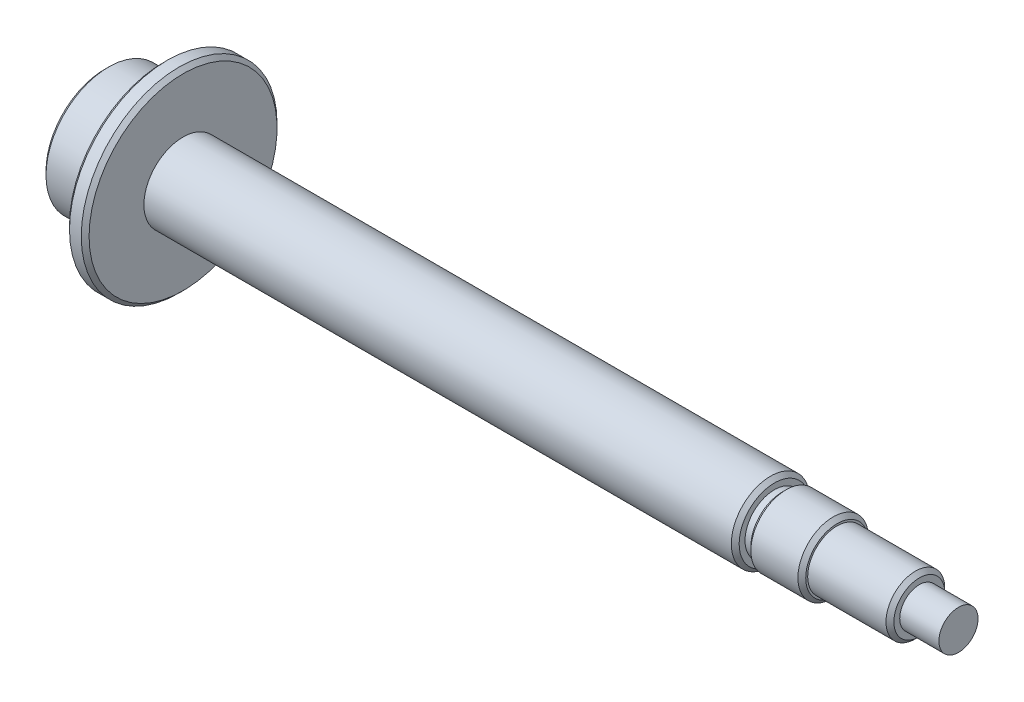
from build123d import *

# Parameters (mm, degrees)
HOLE_WIZARD_M101_D           = 8.5
HOLE_WIZARD_M101_DEPTH       = 24.946342369
HOLE_WIZARD_M101_CSINK_D     = 10.05
HOLE_WIZARD_M101_CSINK_ANGLE = 90
HOLE_WIZARD_M101_TIP         = 2.553657631


with BuildPart() as part:
    # Эскиз1 → Повернуть1 (revolve)
    with BuildSketch(Plane.XY):
        Polygon((0, 0), (0, 15), (1, 16), (15, 16), (15, 24), (16, 25), (19, 25), (20, 24), (20, 10), (170, 10), (171, 9), (171, 7.5), (173, 7.5), (173, 8), (174, 9), (186, 9), (187, 8), (187, 7.5), (207, 7.5), (208, 6.5), (208, 5), (218, 5), (218, 4), (218, 0), align=None)
    revolve(axis=Axis((0, 0, 0), (1, 0, 0)))

    # Отверстие обработанное метчиком M101
    with Locations(Plane.ZY):
        with Locations((0, 0)):
            CounterSinkHole(HOLE_WIZARD_M101_D / 2, HOLE_WIZARD_M101_CSINK_D / 2, depth=HOLE_WIZARD_M101_DEPTH, counter_sink_angle=HOLE_WIZARD_M101_CSINK_ANGLE)
            with Locations((0, 0, -(HOLE_WIZARD_M101_DEPTH + HOLE_WIZARD_M101_TIP / 2))):  # 118° drill point
                Cone(0, HOLE_WIZARD_M101_D / 2, HOLE_WIZARD_M101_TIP, mode=Mode.SUBTRACT)


solid = part.part
